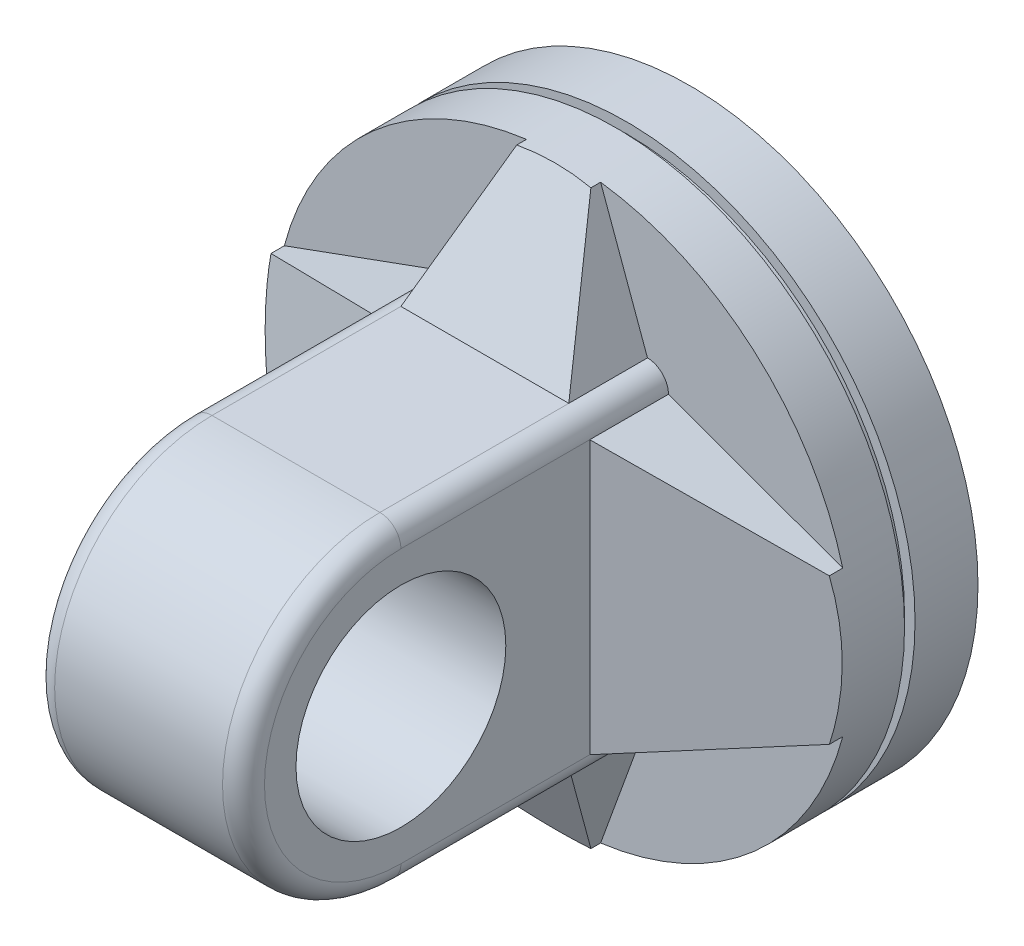
from build123d import *

# Parameters (mm, degrees)
SKETCH1_R           = 275
BOSS_EXTRUDE1_DEPTH = 70
CUT_EXTRUDE1_START  = -10
SKETCH2_R           = 275
SKETCH2_R_2         = 265
CUT_EXTRUDE1_DEPTH  = 10
SKETCH3_R           = 275
BOSS_EXTRUDE2_DEPTH = 50
SKETCH4_R           = 150
SKETCH4_R_2         = 100
BOSS_EXTRUDE3_DEPTH = 100
BOSS_EXTRUDE4_DEPTH = 100
FILLET3_R           = 20
BOSS_EXTRUDE5_DEPTH = 75
CUT_EXTRUDE4_DEPTH  = 150
CUT_EXTRUDE5_DEPTH  = 87.5


with BuildPart() as part:
    # Sketch1 → Boss-Extrude1 (new body)
    with BuildSketch(Plane.XY):
        Circle(SKETCH1_R)
    extrude(amount=BOSS_EXTRUDE1_DEPTH)

    # Sketch2 → Cut-Extrude1 (cut)
    with BuildSketch(Plane.XY.offset(70).offset(CUT_EXTRUDE1_START)):
        Circle(SKETCH2_R)
        Circle(SKETCH2_R_2, mode=Mode.SUBTRACT)
    extrude(amount=CUT_EXTRUDE1_DEPTH, mode=Mode.SUBTRACT)

    # Sketch3 → Boss-Extrude2 (add)
    with BuildSketch(Plane.XY.offset(70)):
        Circle(SKETCH3_R)
    extrude(amount=BOSS_EXTRUDE2_DEPTH)



with BuildPart() as body_2:
    # Sketch4 → Boss-Extrude3 (new, symmetric)
    with BuildSketch(Plane(origin=(0, 0, 0), x_dir=(0, 0, -1), z_dir=(1, 0, 0))):
        with Locations((-375, 0)):
            Circle(SKETCH4_R)
        with Locations((-375, 0)):
            Circle(SKETCH4_R_2, mode=Mode.SUBTRACT)
    extrude(amount=BOSS_EXTRUDE3_DEPTH, both=True)


with BuildPart() as part_1:
    add(part.part)

    add(body_2.part)  # Boss-Extrude4 merges body 2
    # Sketch6 → Boss-Extrude4 (add, symmetric)
    with BuildSketch(Plane(origin=(0, 0, 0), x_dir=(0, 0, -1), z_dir=(1, 0, 0))):
        with BuildLine():
            Line((-375, 150), (-120, 150))
            Line((-120, 150), (-120, -150))
            Line((-120, -150), (-375, -150))
            ThreePointArc((-375, -150), (-225, 0), (-375, 150))
        make_face()
    extrude(amount=BOSS_EXTRUDE4_DEPTH, both=True)

    # Fillet3
    fillet3_edges = [part_1.edges().sort_by_distance(p)[0] for p in [
        (100, 150, 247.5),
        (100, -150, 247.5),
        (-100, 150, 247.5),
        (-100, -150, 247.5),
        (100, 0, 525),
        (-100, 0, 525),
    ]]
    fillet(fillet3_edges, radius=FILLET3_R)

    # Sketch7 → Boss-Extrude5 (add)
    with BuildSketch(Plane.XY.offset(120)):
        with BuildLine():
            Line((80, -150), (-80, -150))
            Line((-80, -150), (-35.333334581, -272.72065464))
            ThreePointArc((-35.333334581, -272.72065464), (0, -275), (35.333334581, -272.72065464))
            Line((35.333334581, -272.72065464), (80, -150))
        make_face()
        with BuildLine():
            ThreePointArc((-266.057108103, 69.560155462), (-275, 0), (-266.057108103, -69.560155462))
            Line((-266.057108103, -69.560155462), (-100, -130))
            Line((-100, -130), (-100, 130))
            Line((-100, 130), (-266.057108103, 69.560155462))
        make_face()
        with BuildLine():
            Line((100, -130), (266.057108103, -69.560155462))
            ThreePointArc((266.057108103, -69.560155462), (275, 0), (266.057108103, 69.560155462))
            Line((266.057108103, 69.560155462), (100, 130))
            Line((100, 130), (100, -130))
        make_face()
        with BuildLine():
            ThreePointArc((35.333334581, 272.72065464), (0, 275), (-35.333334581, 272.72065464))
            Line((-35.333334581, 272.72065464), (-80, 150))
            Line((-80, 150), (80, 150))
            Line((80, 150), (35.333334581, 272.72065464))
        make_face()
    extrude(amount=BOSS_EXTRUDE5_DEPTH)

    # Sketch8 → Cut-Extrude4 (cut, symmetric)
    with BuildSketch(Plane(origin=(0, 0, 0), x_dir=(1, 0, 0), z_dir=(0, 1, 0))):
        Polygon((-300, -120), (-100, -195), (-300, -195), align=None)
        Polygon((300, -120), (100, -195), (300, -195), align=None)
    extrude(amount=CUT_EXTRUDE4_DEPTH, both=True, mode=Mode.SUBTRACT)

    # Sketch9 → Cut-Extrude5 (cut, symmetric)
    with BuildSketch(Plane(origin=(0, 0, 0), x_dir=(0, 0, -1), z_dir=(1, 0, 0))):
        Polygon((-195, 150), (-195, 290), (-120, 290), align=None)
        Polygon((-120, -290), (-195, -150), (-195, -290), align=None)
    extrude(amount=CUT_EXTRUDE5_DEPTH, both=True, mode=Mode.SUBTRACT)


solid = part_1.part
